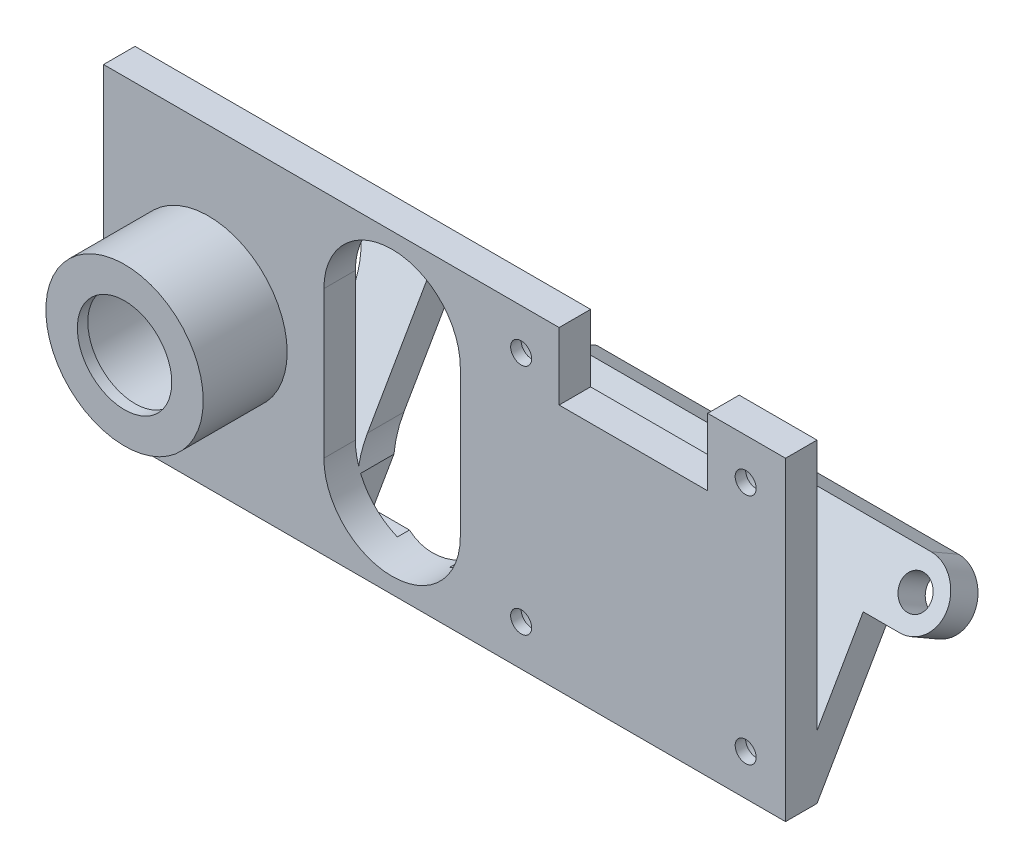
from build123d import *

# Parameters (mm, degrees)
SKETCH1_W               = 65
SKETCH1_H               = 30
BOSS_EXTRUDE1_DEPTH     = 3
SKETCH2_R               = 1
CUT_EXTRUDE1_DEPTH      = 5
SKETCH3_R               = 2.5
CUT_EXTRUDE2_DEPTH      = 2
SKETCH4_W               = 14.16
SKETCH4_H               = 6.4
CUT_EXTRUDE3_DEPTH      = 10
BOSS_EXTRUDE2_DEPTH     = 65
CUT_EXTRUDE4_START      = -60
CUT_EXTRUDE4_DEPTH      = 60
SKETCH7_R               = 1.5
BOSS_EXTRUDE3_DEPTH     = 3
BOSS_EXTRUDE3_2_DEPTH   = 3
CUT_EXTRUDE5_DEPTH      = 44.752699359
CUT_EXTRUDE5_DEPTH_BACK = 44.752699359
SKETCH8_R               = 6.5
CUT_EXTRUDE6_DEPTH      = 43.956940082
CUT_EXTRUDE6_DEPTH_BACK = 43.956940082
CUT_EXTRUDE7_DEPTH      = 3.175426481
CUT_EXTRUDE8_START      = 2
CUT_EXTRUDE8_DEPTH      = 3.695041823
SKETCH12_R              = 4.5
CUT_EXTRUDE9_DEPTH      = 44.752699359
SKETCH14_R              = 5.5
CUT_EXTRUDE10_DEPTH     = 43.956940082
SKETCH15_R              = 7.5
SKETCH15_R_2            = 4.5
BOSS_EXTRUDE4_DEPTH     = 8
SKETCH16_R              = 5.5
CUT_EXTRUDE11_DEPTH     = 10


# Read off the part's stored shape, not the designer's step: Cut-Extrude7, Cut-Extrude8
with BuildPart() as part:
    # Sketch1 → Boss-Extrude1 (new body)
    with BuildSketch(Plane.XY):
        Rectangle(SKETCH1_W, SKETCH1_H)
    extrude(amount=BOSS_EXTRUDE1_DEPTH)

    # Sketch2 → Cut-Extrude1 (cut)
    with BuildSketch(Plane.XY.offset(3)):
        with Locations((7.3, 11.1)):
            Circle(SKETCH2_R)
        with Locations(Location((28.7, 11.1, 0), (0, 0, 180))):
            Circle(SKETCH2_R)
        with Locations((28.7, -11.1)):
            Circle(SKETCH2_R)
        with Locations(Location((7.3, -11.1, 0), (0, 0, 180))):
            Circle(SKETCH2_R)
    extrude(amount=-CUT_EXTRUDE1_DEPTH, mode=Mode.SUBTRACT)

    # Sketch3 → Cut-Extrude2 (cut)
    with BuildSketch(Plane(origin=(0, 0, 0), x_dir=(-1, 0, 0), z_dir=(0, 0, -1))):
        with Locations((-7.3, 11.1)):
            Circle(SKETCH3_R)
        with Locations((-28.7, 11.1)):
            Circle(SKETCH3_R)
        with Locations((-28.7, -11.1)):
            Circle(SKETCH3_R)
        with Locations((-7.3, -11.1)):
            Circle(SKETCH3_R)
    extrude(amount=-CUT_EXTRUDE2_DEPTH, mode=Mode.SUBTRACT)

    # Sketch4 → Cut-Extrude3 (cut)
    with BuildSketch(Plane.XY.offset(3)):
        with Locations((18, 11.8)):
            Rectangle(SKETCH4_W, SKETCH4_H)
    extrude(amount=-CUT_EXTRUDE3_DEPTH, mode=Mode.SUBTRACT)

    # Sketch5 → Boss-Extrude2 (add)
    with BuildSketch(Plane(origin=(32.5, 0, 0), x_dir=(0, 0, -1), z_dir=(1, 0, 0))):
        Polygon((0, -15), (10, 2.320508076), (7.401923789, 3.820508076), (0, -9), align=None)
    extrude(amount=-BOSS_EXTRUDE2_DEPTH)

    # Sketch6 → Cut-Extrude4 (cut)
    with BuildSketch(Plane.XY.offset(CUT_EXTRUDE4_START)):
        with BuildLine():
            Line((8.656465997, -9), (5.943534003, -9))
            ThreePointArc((5.943534003, -9), (7.3, -13.6), (8.656465997, -9))
        make_face()
        with BuildLine():
            Line((30.056465997, -9), (27.343534003, -9))
            ThreePointArc((27.343534003, -9), (28.7, -13.6), (30.056465997, -9))
        make_face()
    extrude(amount=CUT_EXTRUDE4_DEPTH, mode=Mode.SUBTRACT)


with BuildPart() as body_2:
    # Sketch7 → Boss-Extrude3 (new body)
    with BuildSketch(Plane(origin=(0, -2.25, -3.897114317), x_dir=(1, 0, 0), z_dir=(0, 0.49999999999999445, 0.8660254037844419))):
        with BuildLine():
            Line((-35.991007953, 7.009618943), (-32.5, 7.009618943))
            Line((-32.5, 7.009618943), (-32.5, 1.009618943))
            Line((-32.5, 1.009618943), (-35.991007953, 1.009618943))
            ThreePointArc((-35.991007953, 1.009618943), (-38.991007953, 4.009618943), (-35.991007953, 7.009618943))
        make_face()
        with Locations(Location((-35.991007953, 4.009618943, 0), (0, 0, 270))):
            Circle(SKETCH7_R, mode=Mode.SUBTRACT)
    extrude(amount=-BOSS_EXTRUDE3_DEPTH)


with BuildPart() as body_3:
    # Sketch7 → Boss-Extrude3 2 (new body)
    with BuildSketch(Plane(origin=(0, -2.25, -3.897114317), x_dir=(1, 0, 0), z_dir=(0, 0.49999999999999445, 0.8660254037844419))):
        with BuildLine():
            Line((35.991007953, 7.009618943), (32.5, 7.009618943))
            Line((32.5, 7.009618943), (32.5, 1.009618943))
            Line((32.5, 1.009618943), (35.991007953, 1.009618943))
            ThreePointArc((35.991007953, 1.009618943), (38.991007953, 4.009618943), (35.991007953, 7.009618943))
        make_face()
        with Locations(Location((35.991007953, 4.009618943, 0), (0, 0, 270))):
            Circle(SKETCH7_R, mode=Mode.SUBTRACT)
    extrude(amount=-BOSS_EXTRUDE3_2_DEPTH)

    # Combine1: union part, body 2
    add(part.part)
    add(body_2.part)

    # Sketch8 → Cut-Extrude5 (cut, two sides: drawn at the far end of the back side and taken through both)
    with BuildSketch(Plane.XY.offset(3).offset(-CUT_EXTRUDE5_DEPTH_BACK)):
        with Locations(Location((-5, 7, 0), (0, 0, 180))):
            Circle(SKETCH8_R)
        with Locations(Location((-5, -7, 0), (0, 0, 270))):
            Circle(SKETCH8_R)
    extrude(amount=CUT_EXTRUDE5_DEPTH + CUT_EXTRUDE5_DEPTH_BACK, mode=Mode.SUBTRACT)

    # Sketch9 → Cut-Extrude6 (cut, two sides: drawn at the far end of the back side and taken through both)
    with BuildSketch(Plane(origin=(0, 0, 0), x_dir=(-1, 0, 0), z_dir=(0, 0, -1)).offset(-CUT_EXTRUDE6_DEPTH_BACK)):
        with BuildLine():
            Line((-1.5, 7), (-1.5, -7))
            ThreePointArc((-1.5, -7), (5, -13.5), (11.5, -7))
            Line((11.5, -7), (11.5, 7))
            ThreePointArc((11.5, 7), (5, 13.5), (-1.5, 7))
        make_face()
    extrude(amount=CUT_EXTRUDE6_DEPTH + CUT_EXTRUDE6_DEPTH_BACK, mode=Mode.SUBTRACT)

    # Cut-Extrude7 outline → Cut-Extrude7 (cut)
    with BuildSketch(Plane(origin=(0, 0, 0), x_dir=(-1, 0, 0), z_dir=(0, 0, -1))):
        with BuildLine():
            Line((-1, -13), (2.5, -13))
            ThreePointArc((2.5, -13), (0.403805922, -11.596194078), (-1, -9.5))
            Line((-1, -9.5), (-1, -13))
        make_face()
        with BuildLine():
            Line((11, -13), (11, -9.5))
            ThreePointArc((11, -9.5), (9.596194078, -11.596194078), (7.5, -13))
            Line((7.5, -13), (11, -13))
        make_face()
    extrude(amount=CUT_EXTRUDE7_DEPTH, mode=Mode.SUBTRACT)

    # Cut-Extrude8 outline → Cut-Extrude8 (cut)
    with BuildSketch(Plane(origin=(0, 0, 2), x_dir=(-1, 0, 0), z_dir=(0, 0, -1)).offset(CUT_EXTRUDE8_START)):
        with BuildLine():
            Line((-8.656465997, -9), (-5.943534003, -9))
            ThreePointArc((-5.943534003, -9), (-7.3, -8.6), (-8.656465997, -9))
        make_face()
        with BuildLine():
            Line((-30.056465997, -9), (-27.343534003, -9))
            ThreePointArc((-27.343534003, -9), (-28.7, -8.6), (-30.056465997, -9))
        make_face()
    extrude(amount=CUT_EXTRUDE8_DEPTH, mode=Mode.SUBTRACT)

    # Sketch12 → Cut-Extrude9 (cut, through all)
    with BuildSketch(Plane.XY.offset(3)):
        with Locations((-22.5, 0)):
            Circle(SKETCH12_R)
    extrude(amount=-CUT_EXTRUDE9_DEPTH, mode=Mode.SUBTRACT)

    # Sketch14 → Cut-Extrude10 (cut, through all)
    with BuildSketch(Plane(origin=(0, 0, 0), x_dir=(-1, 0, 0), z_dir=(0, 0, -1))):
        with Locations((22.5, 0)):
            Circle(SKETCH14_R)
    extrude(amount=CUT_EXTRUDE10_DEPTH, mode=Mode.SUBTRACT)

    # Sketch15 → Boss-Extrude4 (add)
    with BuildSketch(Plane.XY.offset(3)):
        with Locations((-22.5, 0)):
            Circle(SKETCH15_R)
        with Locations((-22.5, 0)):
            Circle(SKETCH15_R_2, mode=Mode.SUBTRACT)
    extrude(amount=BOSS_EXTRUDE4_DEPTH)

    # Sketch16 → Cut-Extrude11 (cut)
    with BuildSketch(Plane(origin=(0, 0, 0), x_dir=(-1, 0, 0), z_dir=(0, 0, -1))):
        with Locations((22.5, 0)):
            Circle(SKETCH16_R)
    extrude(amount=-CUT_EXTRUDE11_DEPTH, mode=Mode.SUBTRACT)


solid = body_3.part
